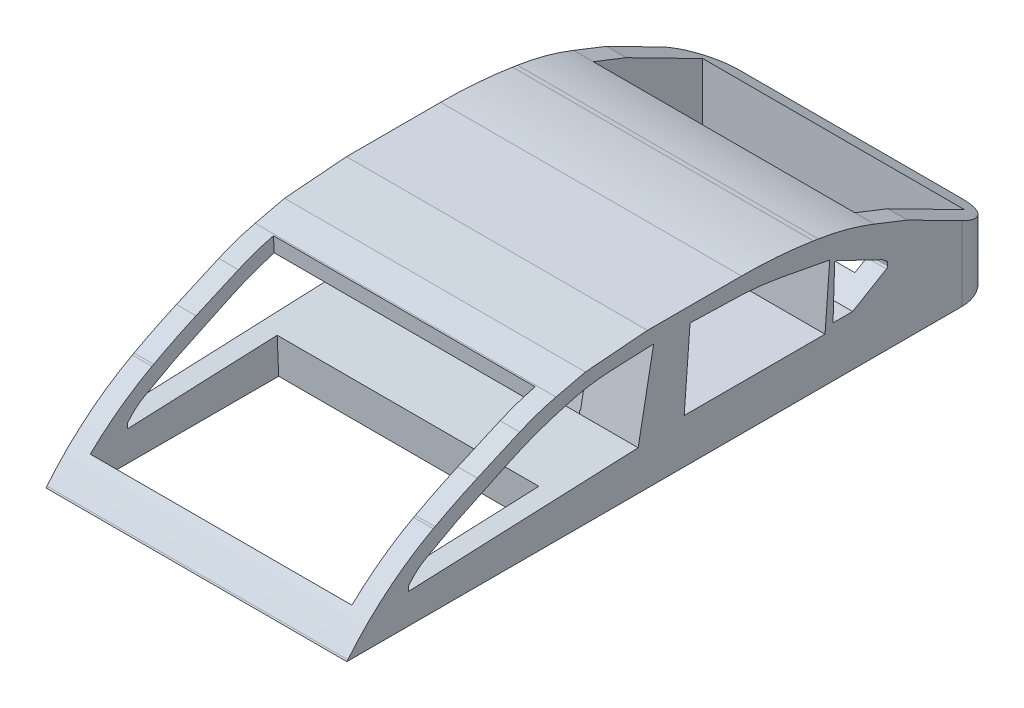
from build123d import *

# Parameters (mm, degrees)
BOSS_EXTRUDE1_DEPTH = 115
CUT_EXTRUDE1_DEPTH  = 115
CUT_EXTRUDE2_START  = 7.5
CUT_EXTRUDE2_DEPTH  = 100
CUT_EXTRUDE3_START  = 7.5
CUT_EXTRUDE3_DEPTH  = 100
CUT_EXTRUDE4_REACH  = 260.68
SKETCH6_W           = 70.076051312
SKETCH6_H           = 19.92290321
CUT_EXTRUDE5_REACH  = 293.015
SKETCH5_W           = 70
SKETCH5_H           = 20.313376992
CUT_EXTRUDE6_REACH  = 334.213
SKETCH7_W           = 70
SKETCH7_H           = 17.498886338
FILLET1_R           = 15


# Read off the part's stored shape, not the designer's step: Cut-Extrude2, Cut-Extrude3
with BuildPart() as part:
    # Sketch1 → Boss-Extrude1 (new body)
    with BuildSketch(Plane(origin=(0, 0, 0), x_dir=(0, 0, -1), z_dir=(1, 0, 0))):
        with BuildLine():
            Line((89.8548345, 121.890508387), (339.8548345, 121.890508387))
            Line((339.8548345, 121.890508387), (339.8548345, 142.698803067))
            Line((339.8548345, 142.698803067), (328.974757131, 148.244473571))
            Line((328.974757131, 148.244473571), (304.07146893, 160.937897169))
            Line((304.07146893, 160.937897169), (291.499350701, 165.900575417))
            ThreePointArc((291.499350701, 165.900575417), (280.939522904, 169.403551358), (270.055923817, 171.711813574))
            Line((270.055923817, 171.711813574), (268.171463935, 172.003048284))
            ThreePointArc((268.171463935, 172.003048284), (254.466056361, 173.586145336), (240.679656072, 174.114879761))
            Line((240.679656072, 174.114879761), (232.021178794, 174.114879761))
            Line((232.021178794, 174.114879761), (204.700095622, 174.114879761))
            Line((204.700095622, 174.114879761), (181.005704906, 172.180643784))
            Line((181.005704906, 172.180643784), (169.793278807, 169.525069181))
            ThreePointArc((169.793278807, 169.525069181), (162.738148163, 167.508293641), (155.897481651, 164.85357451))
            Line((155.897481651, 164.85357451), (139.701268702, 157.697108323))
            ThreePointArc((139.701268702, 157.697108323), (131.522677332, 153.88092637), (123.507487012, 149.732513946))
            Line((123.507487012, 149.732513946), (122.849499947, 149.374661332))
            ThreePointArc((122.849499947, 149.374661332), (105.217865801, 137.440006065), (90.215677989, 122.332230589))
            Line((90.215677989, 122.332230589), (89.8548345, 121.890508387))
        make_face()
    extrude(amount=BOSS_EXTRUDE1_DEPTH)

    # Sketch2 → Cut-Extrude1 (cut)
    with BuildSketch(Plane(origin=(115, 0, 0), x_dir=(0, 0, -1), z_dir=(1, 0, 0))):
        with BuildLine():
            Line((113.475739659, 133.359325966), (201.174236889, 137.018348058))
            Line((201.174236889, 137.018348058), (207.075885424, 168.415118264))
            Line((207.075885424, 168.415118264), (192.666474105, 167.813918061))
            Line((192.666474105, 167.813918061), (190.829871081, 167.73728994))
            ThreePointArc((190.829871081, 167.73728994), (182.233808887, 166.844681368), (173.813252446, 164.899619793))
            Line((173.813252446, 164.899619793), (169.2892062, 163.555605085))
            ThreePointArc((169.2892062, 163.555605085), (160.569837528, 160.5967142), (152.103009161, 156.977979241))
            Line((152.103009161, 156.977979241), (131.888883088, 147.40524948))
            Line((131.888883088, 147.40524948), (120.054289503, 140.950016615))
            ThreePointArc((120.054289503, 140.950016615), (116.601738736, 138.565427019), (113.722697716, 135.512969462))
            Line((113.722697716, 135.512969462), (113.475739659, 135.188837012))
            Line((113.475739659, 135.188837012), (113.475739659, 133.359325966))
        make_face()
        with BuildLine():
            Line((221.003775967, 168.415118264), (218.761149524, 138.906875589))
            Line((218.761149524, 138.906875589), (272.584184163, 138.906875589))
            Line((272.584184163, 138.906875589), (274.383679522, 162.58444611))
            Line((274.383679522, 162.58444611), (267.028526617, 163.966993649))
            Line((267.028526617, 163.966993649), (257.016670223, 165.848921543))
            Line((257.016670223, 165.848921543), (255.744876296, 166.087980551))
            ThreePointArc((255.744876296, 166.087980551), (245.628472921, 167.506912168), (235.424062848, 167.981253005))
            Line((235.424062848, 167.981253005), (234.695600568, 167.981253005))
            Line((234.695600568, 167.981253005), (221.003775967, 168.415118264))
        make_face()
        with BuildLine():
            Line((276.275786009, 160.987395212), (275.646964577, 141.143186512))
            Line((275.646964577, 141.143186512), (283.14790924, 141.143186512))
            Line((283.14790924, 141.143186512), (294.416525801, 147.803376186))
            Line((294.416525801, 147.803376186), (296.046101937, 148.766518919))
            ThreePointArc((296.046101937, 148.766518919), (296.405855365, 149.13182216), (296.537289859, 149.627396535))
            Line((296.537289859, 149.627396535), (296.537289859, 150.540124257))
            ThreePointArc((296.537289859, 150.540124257), (296.433404588, 150.983946735), (296.143333074, 151.335555977))
            Line((296.143333074, 151.335555977), (294.416525801, 152.651218661))
            Line((294.416525801, 152.651218661), (277.097452917, 160.987395212))
            Line((277.097452917, 160.987395212), (276.275786009, 160.987395212))
        make_face()
    extrude(amount=-CUT_EXTRUDE1_DEPTH, mode=Mode.SUBTRACT)

    # Cut-Extrude2 outline → Cut-Extrude2 (cut)
    with BuildSketch(Plane.YZ.offset(CUT_EXTRUDE2_START)):
        with BuildLine():
            Line((121.890508387, -99.688159251), (121.890508387, -171.289102204))
            Line((121.890508387, -171.289102204), (135.747336393, -170.710957294))
            Line((135.747336393, -170.710957294), (133.359325966, -113.475739659))
            Line((133.359325966, -113.475739659), (135.188837012, -113.475739659))
            Line((135.188837012, -113.475739659), (135.512969462, -113.722697716))
            ThreePointArc((135.512969462, -113.722697716), (138.565427019, -116.601738736), (140.950016615, -120.054289503))
            Line((140.950016615, -120.054289503), (147.40524948, -131.888883088))
            Line((147.40524948, -131.888883088), (156.977979241, -152.103009161))
            ThreePointArc((156.977979241, -152.103009161), (160.5967142, -160.569837528), (163.555605085, -169.2892062))
            Line((163.555605085, -169.2892062), (163.632345036, -169.547518172))
            Line((163.632345036, -169.547518172), (169.408178174, -169.306534555))
            ThreePointArc((169.408178174, -169.306534555), (167.428165725, -162.501028912), (164.85357451, -155.897481651))
            Line((164.85357451, -155.897481651), (157.697108323, -139.701268702))
            ThreePointArc((157.697108323, -139.701268702), (153.88092637, -131.522677332), (149.732513946, -123.507487012))
            Line((149.732513946, -123.507487012), (149.374661332, -122.849499947))
            ThreePointArc((149.374661332, -122.849499947), (141.537958861, -110.480020928), (132.127738515, -99.261033903))
            Line((132.127738515, -99.261033903), (121.890508387, -99.688159251))
        make_face()
    extrude(amount=CUT_EXTRUDE2_DEPTH, mode=Mode.SUBTRACT)

    # Cut-Extrude3 outline → Cut-Extrude3 (cut)
    with BuildSketch(Plane.YZ.offset(CUT_EXTRUDE3_START)):
        with BuildLine():
            Line((121.890508387, -291.499350701), (121.890508387, -333.35633566))
            Line((121.890508387, -333.35633566), (146.011144709, -333.35633566))
            Line((146.011144709, -333.35633566), (160.937897169, -304.07146893))
            Line((160.937897169, -304.07146893), (165.900575417, -291.499350701))
            Line((165.900575417, -291.499350701), (154.055340396, -291.499350701))
            Line((154.055340396, -291.499350701), (152.651218661, -294.416525801))
            Line((152.651218661, -294.416525801), (151.335555977, -296.143333074))
            ThreePointArc((151.335555977, -296.143333074), (150.983946735, -296.433404588), (150.540124257, -296.537289859))
            Line((150.540124257, -296.537289859), (149.627396535, -296.537289859))
            ThreePointArc((149.627396535, -296.537289859), (149.13182216, -296.405855365), (148.766518919, -296.046101937))
            Line((148.766518919, -296.046101937), (146.079212499, -291.499350701))
            Line((146.079212499, -291.499350701), (121.890508387, -291.499350701))
        make_face()
    extrude(amount=CUT_EXTRUDE3_DEPTH, mode=Mode.SUBTRACT)

    # Cut-Extrude4: up to this plane
    cut_extrude4_end = Plane(origin=(0, 137.018348058, -201.174236889), z_dir=(0, -0.18473466771426061, -0.9827884322398701))
    # Sketch6 → Cut-Extrude4 (cut, up to the surface)
    with BuildSketch(Plane(origin=(0, -15.732649467, -207.008545619), x_dir=(-1, 0, 0), z_dir=(0, -0.07578145826840303, -0.9971244509000441)), mode=Mode.PRIVATE) as cut_extrude4_sk1:
        with Locations((-57.714978641, 162.925898332)):
            Rectangle(SKETCH6_W, SKETCH6_H)
    cut_extrude4_tool1 = split(extrude(cut_extrude4_sk1.sketch, amount=-CUT_EXTRUDE4_REACH, mode=Mode.PRIVATE), bisect_by=cut_extrude4_end, keep=Keep.BOTH, mode=Mode.PRIVATE)
    add(cut_extrude4_tool1.solids().sort_by_distance((57.714979, 146.724747, -219.355308))[0], mode=Mode.SUBTRACT)

    # Cut-Extrude5: up to this plane
    cut_extrude5_end = Plane(origin=(0, 168.415118264, -221.003775967), z_dir=(0, 0.07578145826840302, 0.9971244509000441))
    # Sketch5 → Cut-Extrude5 (cut, up to the surface)
    with BuildSketch(Plane(origin=(0, -31.848196468, -169.432405211), x_dir=(1, 0, 0), z_dir=(0, 0.18473466771426064, 0.9827884322398701)), mode=Mode.PRIVATE) as cut_extrude5_sk1:
        with Locations((57.5, 181.980591777)):
            Rectangle(SKETCH5_W, SKETCH5_H)
    cut_extrude5_tool1 = split(extrude(cut_extrude5_sk1.sketch, amount=-CUT_EXTRUDE5_REACH, mode=Mode.PRIVATE), bisect_by=cut_extrude5_end, keep=Keep.BOTH, mode=Mode.PRIVATE)
    add(cut_extrude5_tool1.solids().sort_by_distance((57.5, 147.000224, -203.050529))[0], mode=Mode.SUBTRACT)

    # Cut-Extrude6: up to this plane
    cut_extrude6_end = Plane(origin=(115, 121.890508387, -89.8548345), z_dir=(0, 1, 0))
    # Sketch7 → Cut-Extrude6 (cut, up to the surface)
    with BuildSketch(Plane(origin=(0, 168.866544526, -31.741831678), x_dir=(1, 0, 0), z_dir=(0, 0.9827884322398701, -0.18473466771426067)), mode=Mode.PRIVATE) as cut_extrude6_sk1:
        with Locations((57.5, 181.149117049)):
            Rectangle(SKETCH7_W, SKETCH7_H)
    cut_extrude6_tool1 = split(extrude(cut_extrude6_sk1.sketch, amount=-CUT_EXTRUDE6_REACH, mode=Mode.PRIVATE), bisect_by=cut_extrude6_end, keep=Keep.BOTH, mode=Mode.PRIVATE)
    add(cut_extrude6_tool1.solids().sort_by_distance((57.5, 135.402023, -209.773088))[0], mode=Mode.SUBTRACT)

    # Fillet1
    fillet1_edges = [part.edges().sort_by_distance(p)[0] for p in [
        (115, 132.294655727, -339.8548345),
        (0, 132.294655727, -339.8548345),
    ]]
    fillet(fillet1_edges, radius=FILLET1_R)


solid = part.part
